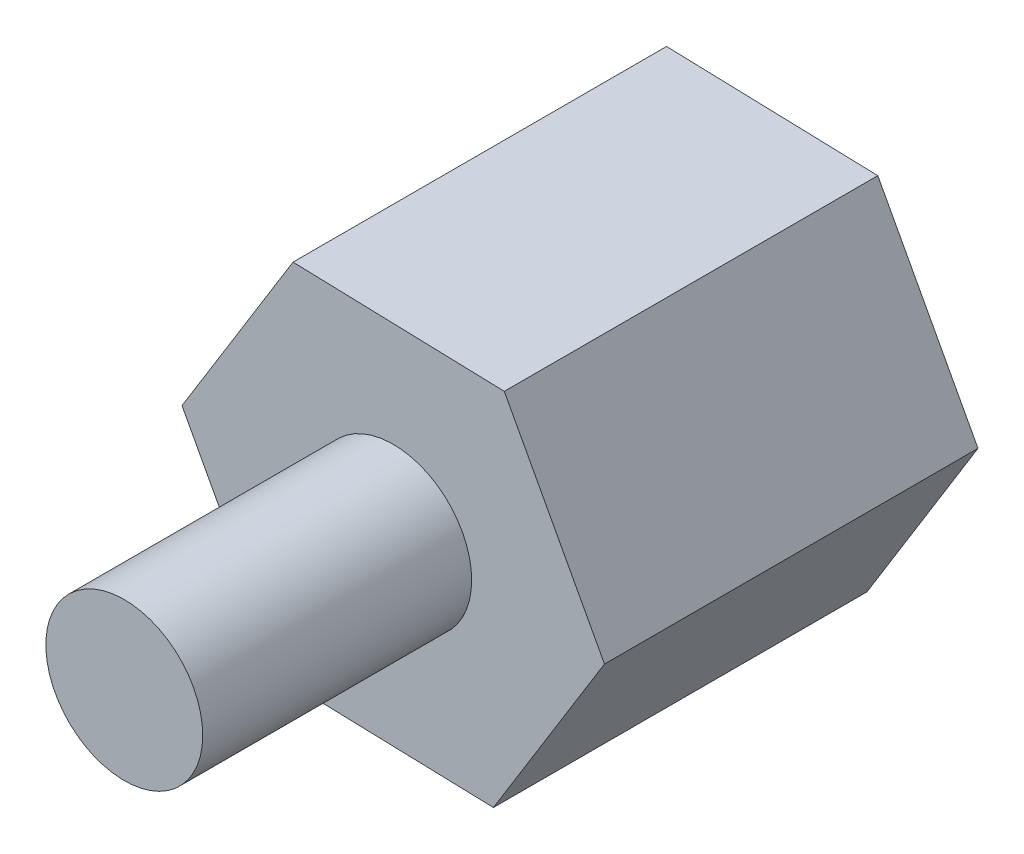
from build123d import *

# Parameters (mm, degrees)
EXTRUDE1_DEPTH = 6.35
SKETCH2_R      = 1.3335
EXTRUDE2_DEPTH = 4.572
SKETCH3_R      = 1.3335
EXTRUDE3_DEPTH = 5.08


with BuildPart() as part:
    # Sketch1 → Extrude1 (new body)
    with BuildSketch(Plane.XY):
        Polygon((1.888017478, 3.056790202), (-1.70324923, 3.163466199), (-3.591266708, 0.106675997), (-1.888017478, -3.056790202), (1.70324923, -3.163466199), (3.591266708, -0.106675997), align=None)
    extrude(amount=EXTRUDE1_DEPTH)

    # Sketch2 → Extrude2 (add)
    with BuildSketch(Plane.XY.offset(6.35)):
        Circle(SKETCH2_R)
    extrude(amount=EXTRUDE2_DEPTH)

    # Sketch3 → Extrude3 (cut)
    with BuildSketch(Plane(origin=(0, 0, 0), x_dir=(-1, 0, 0), z_dir=(0, 0, -1))):
        Circle(SKETCH3_R)
    extrude(amount=-EXTRUDE3_DEPTH, mode=Mode.SUBTRACT)


solid = part.part
